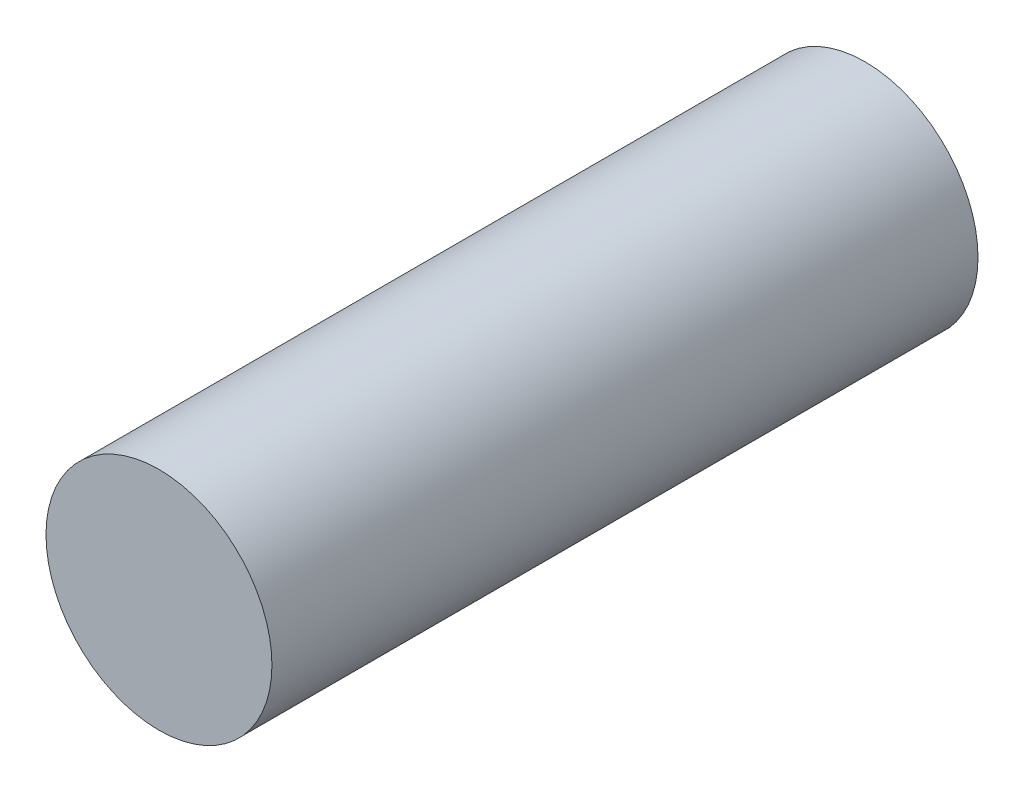
from build123d import *

# Parameters (mm, degrees)
SKETCH1_R           = 4
BOSS_EXTRUDE1_DEPTH = 25


with BuildPart() as part:
    # Sketch1 → Boss-Extrude1 (new body)
    with BuildSketch(Plane.XY):
        with Locations((-36.861518938, 18.474434255)):
            Circle(SKETCH1_R)
    extrude(amount=BOSS_EXTRUDE1_DEPTH)


solid = part.part
